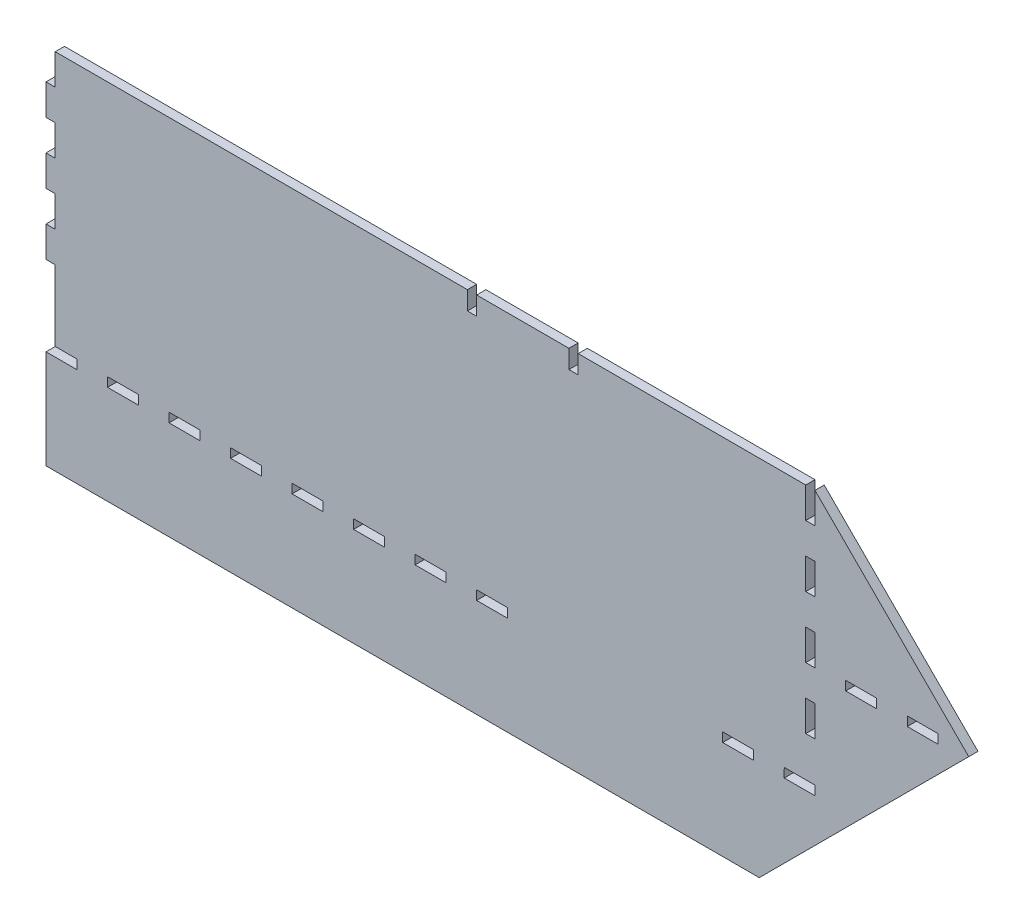
from build123d import *

# Parameters (mm, degrees)
SKETCH1_W           = 10
SKETCH1_H           = 3
SKETCH1_W_2         = 3
SKETCH1_H_2         = 10
BOSS_EXTRUDE1_DEPTH = 3


with BuildPart() as part:
    # Sketch1 → Boss-Extrude1 (new body)
    with BuildSketch(Plane.XY):
        Polygon((-112.631023813, -53.728350242), (-112.631023813, -63.840272517), (-112.631023813, -85.840272517), (119.257053912, -85.840272517), (137.368976187, -67.728350242), (187.368976187, -17.728350242), (137.368976187, 32.271649758), (137.368976187, 22.271649758), (134.368976187, 22.271649758), (134.368976187, 32.271649758), (60.378976187, 32.271649758), (60.378976187, 26.271649758), (57.378976187, 26.271649758), (57.378976187, 32.271649758), (42.378976187, 32.271649758), (27.378976187, 32.271649758), (27.378976187, 26.271649758), (24.378976187, 26.271649758), (24.378976187, 32.271649758), (-62.631023813, 32.271649758), (-109.631023813, 32.271649758), (-109.631023813, 22.271649758), (-112.631023813, 22.271649758), (-112.631023813, 12.271649758), (-109.631023813, 12.271649758), (-109.631023813, 2.271649758), (-112.631023813, 2.271649758), (-112.631023813, -7.728350242), (-109.631023813, -7.728350242), (-109.631023813, -17.728350242), (-112.631023813, -17.728350242), (-112.631023813, -27.728350242), (-109.631023813, -27.728350242), (-109.631023813, -50.728350242), (-102.631023813, -50.728350242), (-102.631023813, -53.728350242), align=None)
        with Locations((-87.631023813, -52.228350242)):
            Rectangle(SKETCH1_W, SKETCH1_H, mode=Mode.SUBTRACT)
        with Locations((-67.631023813, -52.228350242)):
            Rectangle(SKETCH1_W, SKETCH1_H, mode=Mode.SUBTRACT)
        with Locations((-47.631023813, -52.228350242)):
            Rectangle(SKETCH1_W, SKETCH1_H, mode=Mode.SUBTRACT)
        with Locations((-27.631023813, -52.228350242)):
            Rectangle(SKETCH1_W, SKETCH1_H, mode=Mode.SUBTRACT)
        with Locations((-7.631023813, -52.228350242)):
            Rectangle(SKETCH1_W, SKETCH1_H, mode=Mode.SUBTRACT)
        with Locations((12.368976187, -52.228350242)):
            Rectangle(SKETCH1_W, SKETCH1_H, mode=Mode.SUBTRACT)
        Polygon((27.368976187, -50.728350242), (37.371405326, -50.728350242), (37.368976187, -53.728350242), (27.368976187, -53.728350242), align=None, mode=Mode.SUBTRACT)
        Polygon((107.3787447, -50.728350242), (117.381121881, -50.728350242), (117.369073889, -53.728350242), (107.369073889, -53.728350242), align=None, mode=Mode.SUBTRACT)
        Polygon((127.381202522, -50.728350242), (137.381202522, -50.728350242), (137.36915453, -53.728350242), (127.36915453, -53.728350242), align=None, mode=Mode.SUBTRACT)
        with Locations((135.868976187, -32.728350242)):
            Rectangle(SKETCH1_W_2, SKETCH1_H_2, mode=Mode.SUBTRACT)
        with Locations((135.868976187, -12.728350242)):
            Rectangle(SKETCH1_W_2, SKETCH1_H_2, mode=Mode.SUBTRACT)
        with Locations((152.368976187, -17.728350242)):
            Rectangle(SKETCH1_W, SKETCH1_H, mode=Mode.SUBTRACT)
        with Locations((172.368976187, -17.728350242)):
            Rectangle(SKETCH1_W, SKETCH1_H, mode=Mode.SUBTRACT)
        with Locations((135.868976187, 7.271649758)):
            Rectangle(SKETCH1_W_2, SKETCH1_H_2, mode=Mode.SUBTRACT)
    extrude(amount=BOSS_EXTRUDE1_DEPTH)


solid = part.part
